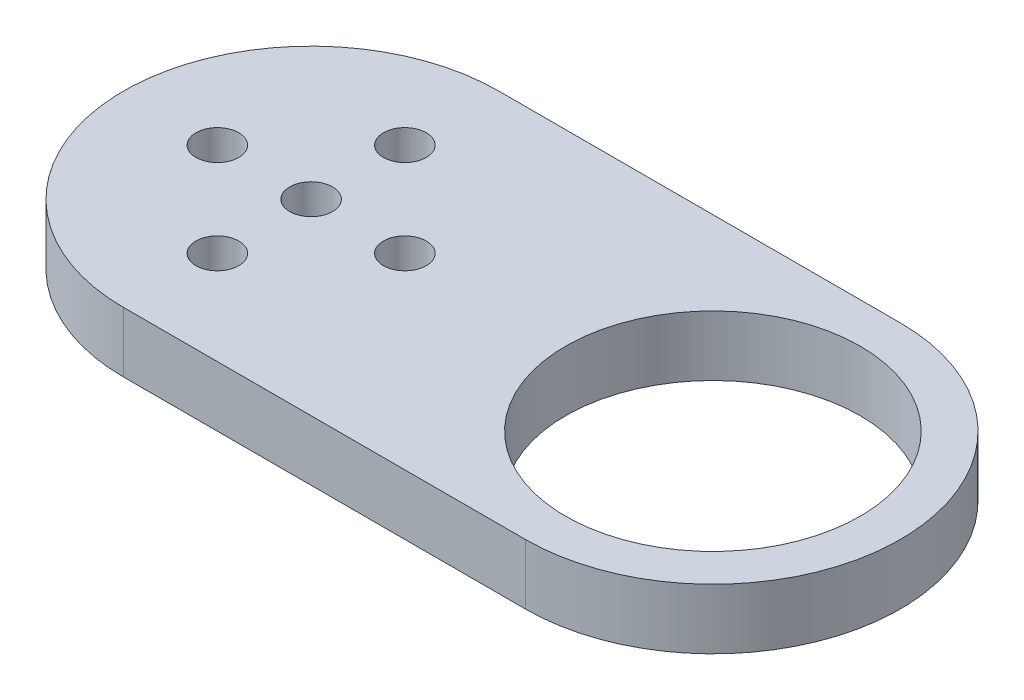
from build123d import *

# Parameters (mm, degrees)
BOSS_EXTRUDE1_DEPTH     = 4.5
SKETCH4_R               = 1.6
SERVO_HORN_HOLES_DEPTH  = 33.515380976
SKETCH5_R               = 11
BEARING_PRESS_FIT_DEPTH = 33.515380976


with BuildPart() as part:
    # Sketch2 → Boss-Extrude1 (new body)
    with BuildSketch(Plane(origin=(0, 0, 0), x_dir=(1, 0, 0), z_dir=(0, 1, 0))):
        with BuildLine():
            Line((15, 14), (-15, 14))
            ThreePointArc((-15, 14), (-29, 0), (-15, -14))
            Line((-15, -14), (15, -14))
            ThreePointArc((15, -14), (29, 0), (15, 14))
        make_face()
    extrude(amount=BOSS_EXTRUDE1_DEPTH)

    # Sketch4 → Servo horn holes (cut, through all)
    with BuildSketch(Plane(origin=(0, 4.5, 0), x_dir=(1, 0, 0), z_dir=(0, 1, 0))):
        with Locations((-15, 0)):
            Circle(SKETCH4_R)
        with Locations((-8, 0)):
            Circle(SKETCH4_R)
        with Locations((-15, -7)):
            Circle(SKETCH4_R)
        with Locations((-22, 0)):
            Circle(SKETCH4_R)
        with Locations((-15, 7)):
            Circle(SKETCH4_R)
    extrude(amount=-SERVO_HORN_HOLES_DEPTH, mode=Mode.SUBTRACT)

    # Sketch5 → Bearing press fit (cut, through all)
    with BuildSketch(Plane(origin=(0, 0, 0), x_dir=(-1, 0, 0), z_dir=(0, -1, 0))):
        with Locations((-15, 0)):
            Circle(SKETCH5_R)
    extrude(amount=-BEARING_PRESS_FIT_DEPTH, mode=Mode.SUBTRACT)


solid = part.part
